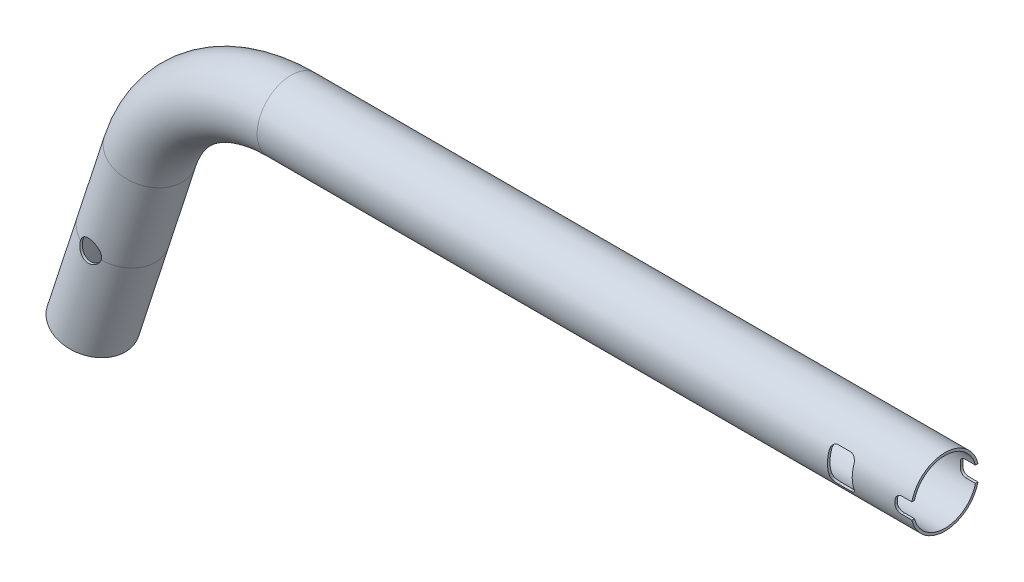
from build123d import *

# Parameters (mm, degrees)
SKETCH3_R               = 11
SKETCH3_R_2             = 10.2
CUT_EXTRUDE1_REACH      = 195.255
SKETCH4_R               = 3.5
SKETCH5_R               = 3.3
CUT_EXTRUDE2_DEPTH      = 194.255219932
CUT_EXTRUDE3_DEPTH      = 194.255219932
CUT_EXTRUDE3_DEPTH_BACK = 194.255219932


with BuildPart() as part:
    # Sweep2: sweep along a path in Sketch1
    with BuildLine(Plane.XY) as sweep2_path:
        Line((117.250388441, 0), (94.250388441, 0))
        Line((94.250388441, 0), (-94.250388441, 0))
        ThreePointArc((-94.250388441, 0), (-122.464080551, -9.16718427), (-139.901101223, -33.16718427))
        Line((-139.901101223, -33.16718427), (-148.619611559, -60))
        Line((-148.619611559, -60), (-158.367202446, -90))
    # Sketch3 → Sweep2 (sweep)
    with BuildSketch(Plane(origin=(94.250388441, 0, 0), x_dir=(0, 0, -1), z_dir=(1, 0, 0))):
        Circle(SKETCH3_R)
        Circle(SKETCH3_R_2, mode=Mode.SUBTRACT)
    sweep(path=sweep2_path.line)

    # Sketch4 → Cut-Extrude1 (cut, up to next)
    with BuildSketch(Plane.XY, mode=Mode.PRIVATE) as cut_extrude1_sk1:
        with Locations((-148.619611559, -60)):
            Circle(SKETCH4_R)
    cut_extrude1_tool1 = extrude(cut_extrude1_sk1.sketch, amount=CUT_EXTRUDE1_REACH, mode=Mode.PRIVATE) & part.part
    # Sketch4 → Cut-Extrude1 (cut, up to next)
    with BuildSketch(Plane.XY, mode=Mode.PRIVATE) as cut_extrude1_sk2:
        with BuildLine():
            Line((92.250388441, -5.5), (96.250388441, -5.5))
            ThreePointArc((96.250388441, -5.5), (97.664602003, -4.914213562), (98.250388441, -3.5))
            Line((98.250388441, -3.5), (98.250388441, 3.5))
            ThreePointArc((98.250388441, 3.5), (97.664602003, 4.914213562), (96.250388441, 5.5))
            Line((96.250388441, 5.5), (92.250388441, 5.5))
            ThreePointArc((92.250388441, 5.5), (90.836174879, 4.914213562), (90.250388441, 3.5))
            Line((90.250388441, 3.5), (90.250388441, -3.5))
            ThreePointArc((90.250388441, -3.5), (90.836174879, -4.914213562), (92.250388441, -5.5))
        make_face()
    cut_extrude1_tool2 = extrude(cut_extrude1_sk2.sketch, amount=CUT_EXTRUDE1_REACH, mode=Mode.PRIVATE) & part.part
    add(cut_extrude1_tool1.solids().sort_by_distance((-148.619612, -60, 0))[0], mode=Mode.SUBTRACT)
    add(cut_extrude1_tool2.solids().sort_by_distance((94.250388, 0, 0))[0], mode=Mode.SUBTRACT)

    # Sketch5 → Cut-Extrude2 (cut, through all)
    with BuildSketch(Plane.XY):
        with Locations((-148.619611559, -60)):
            Circle(SKETCH5_R)
    extrude(amount=-CUT_EXTRUDE2_DEPTH, mode=Mode.SUBTRACT)

    # Sketch6 → Cut-Extrude3 (cut, two sides: drawn at the far end of the back side and taken through both)
    with BuildSketch(Plane.XY.offset(-CUT_EXTRUDE3_DEPTH_BACK)):
        with BuildLine():
            Line((117.324174497, 2.554733627), (117.250388441, -2.554733627))
            Line((117.250388441, -2.554733627), (114.050388441, -2.554733627))
            ThreePointArc((114.050388441, -2.554733627), (112.636174879, -1.968947189), (112.050388441, -0.554733627))
            Line((112.050388441, -0.554733627), (112.050388441, 0.554733627))
            ThreePointArc((112.050388441, 0.554733627), (112.636174879, 1.968947189), (114.050388441, 2.554733627))
            Line((114.050388441, 2.554733627), (117.324174497, 2.554733627))
        make_face()
    extrude(amount=CUT_EXTRUDE3_DEPTH + CUT_EXTRUDE3_DEPTH_BACK, mode=Mode.SUBTRACT)


solid = part.part
